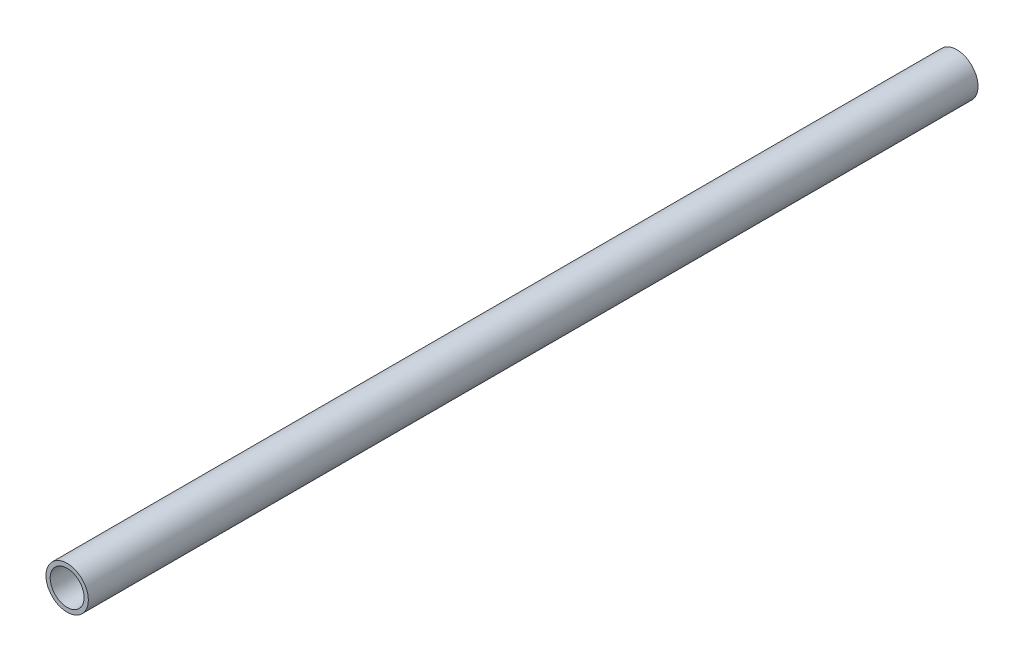
from build123d import *

# Parameters (mm, degrees)
SKETCH1_R   = 5
SKETCH1_R_2 = 4
BODY_DEPTH  = 210


with BuildPart() as part:
    # Sketch1 → body (new body)
    with BuildSketch(Plane.XY):
        Circle(SKETCH1_R)
        Circle(SKETCH1_R_2, mode=Mode.SUBTRACT)
    extrude(amount=BODY_DEPTH)


solid = part.part
